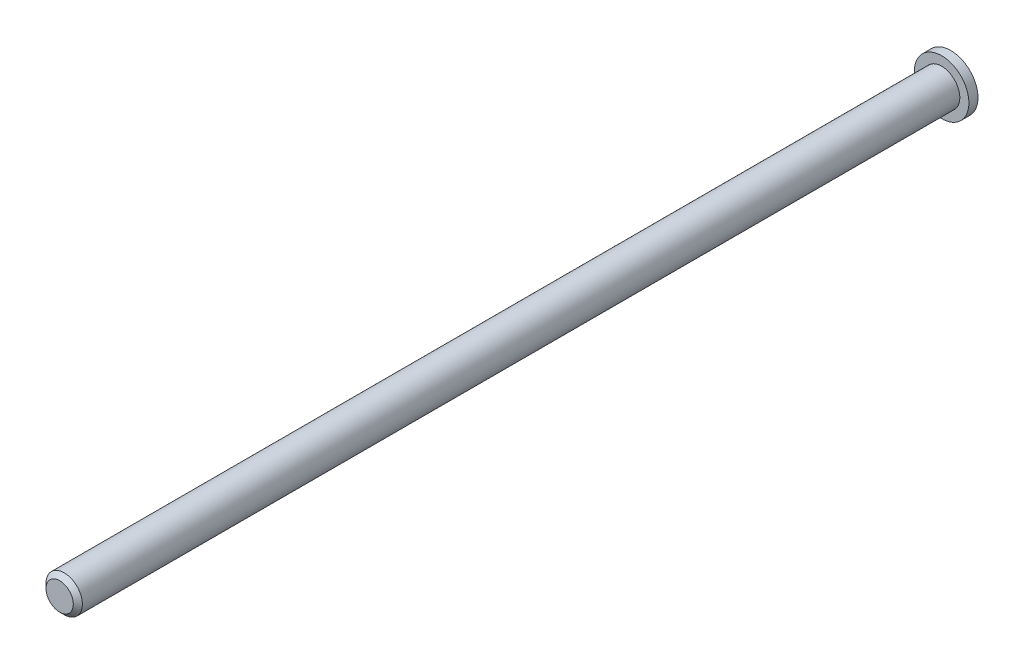
from build123d import *

# Parameters (mm, degrees)
SKETCH1_R           = 1.5
BOSS_EXTRUDE1_DEPTH = 0.5
SKETCH2_R           = 1
BOSS_EXTRUDE2_DEPTH = 48.5
CHAMFER1_SIZE       = 0.25


with BuildPart() as part:
    # Sketch1 → Boss-Extrude1 (new body)
    with BuildSketch(Plane.XY):
        Circle(SKETCH1_R)
    extrude(amount=BOSS_EXTRUDE1_DEPTH)

    # Sketch2 → Boss-Extrude2 (add)
    with BuildSketch(Plane.XY.offset(0.5)):
        Circle(SKETCH2_R)
    extrude(amount=BOSS_EXTRUDE2_DEPTH)

    # Chamfer1
    chamfer1_edges = [part.edges().sort_by_distance(p)[0] for p in [
        (-1, 0, 49),
    ]]
    chamfer(chamfer1_edges, length=CHAMFER1_SIZE)


solid = part.part
